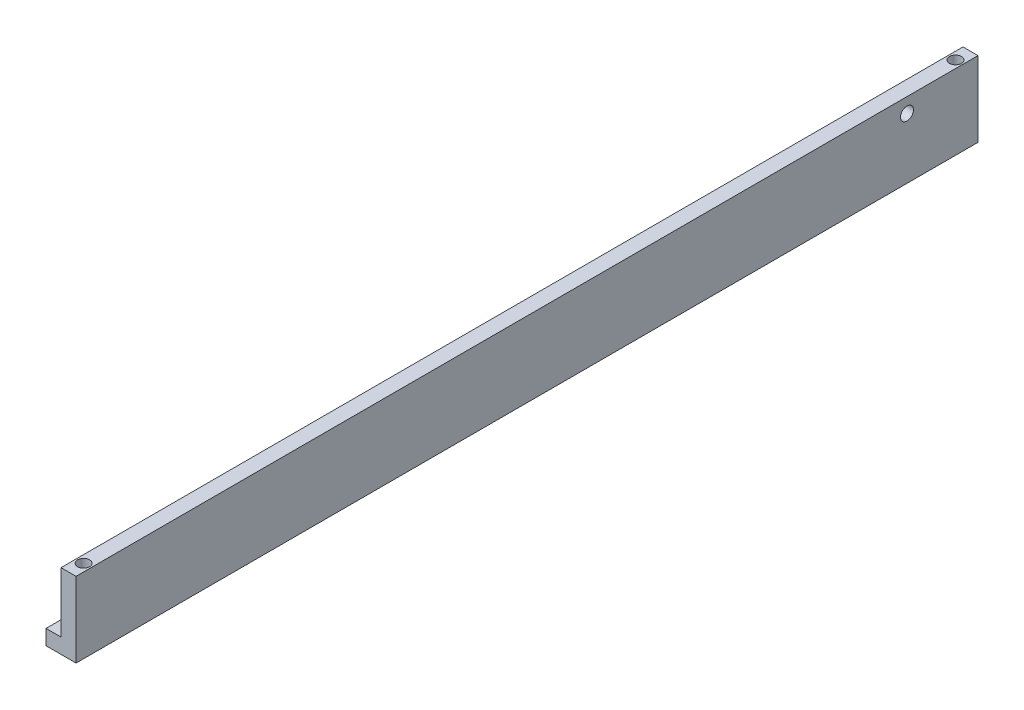
from build123d import *

# Parameters (mm, degrees)
SKETCH1_W           = 6.35
SKETCH1_H           = 31.75
BOSS_EXTRUDE1_DEPTH = 381
SKETCH1_3_W         = 6.35
SKETCH1_3_H         = 31.75
BOSS_EXTRUDE2_DEPTH = 25.4
SKETCH5_W           = 6.35
SKETCH5_H           = 6.35
BOSS_EXTRUDE3_DEPTH = 35.56
SKETCH2_R           = 2.54
CUT_EXTRUDE4_DEPTH  = 7.62
CUT_EXTRUDE5_START  = -7.62
SKETCH3_R           = 2.54
CUT_EXTRUDE5_DEPTH  = 7.62
SKETCH7_R           = 2.75
CUT_EXTRUDE6_DEPTH  = 383.531505238


with BuildPart() as part:
    # Sketch1 → Boss-Extrude1 (new body)
    with BuildSketch(Plane.XY):
        with Locations((-3.175, 15.875)):
            Rectangle(SKETCH1_W, SKETCH1_H)
    extrude(amount=BOSS_EXTRUDE1_DEPTH)

    # Sketch1<3> → Boss-Extrude2 (add)
    with BuildSketch(Plane.XY):
        with Locations((-3.175, 15.875)):
            Rectangle(SKETCH1_3_W, SKETCH1_3_H)
    extrude(amount=BOSS_EXTRUDE2_DEPTH)

    # Sketch5 → Boss-Extrude3 (add)
    with BuildSketch(Plane.XY.offset(381)):
        with Locations((-9.525, 3.175)):
            Rectangle(SKETCH5_W, SKETCH5_H)
    extrude(amount=-BOSS_EXTRUDE3_DEPTH)

    # Sketch2 → Cut-Extrude4 (cut)
    with BuildSketch(Plane(origin=(0, 31.75, 0), x_dir=(1, 0, 0), z_dir=(0, 1, 0))):
        with Locations((-3.175, -374.65)):
            Circle(SKETCH2_R)
        with Locations((-3.175, -6.35)):
            Circle(SKETCH2_R)
    extrude(amount=-CUT_EXTRUDE4_DEPTH, mode=Mode.SUBTRACT)

    # Sketch3 → Cut-Extrude5 (cut)
    with BuildSketch(Plane.XZ.offset(CUT_EXTRUDE5_START)):
        with Locations((-3.175, 374.65)):
            Circle(SKETCH3_R)
        with Locations((-3.175, 6.35)):
            Circle(SKETCH3_R)
    extrude(amount=CUT_EXTRUDE5_DEPTH, mode=Mode.SUBTRACT)

    # Sketch7 → Cut-Extrude6 (cut, through all)
    with BuildSketch(Plane(origin=(0, 0, 0), x_dir=(0, 0, -1), z_dir=(1, 0, 0))):
        with Locations((-30, 25.5625)):
            Circle(SKETCH7_R)
    extrude(amount=-CUT_EXTRUDE6_DEPTH, mode=Mode.SUBTRACT)


solid = part.part
